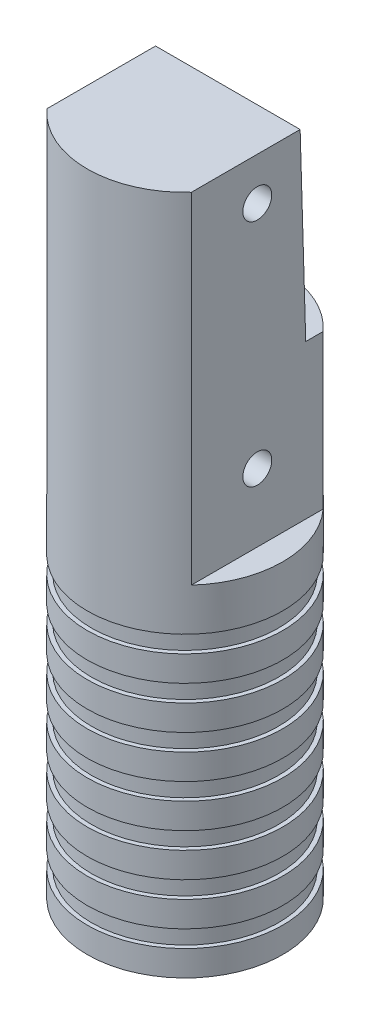
from build123d import *

# Parameters (mm, degrees)
SKETCH2_W                      = 11.5
SKETCH2_H                      = 40
SKETCH3_W                      = 0.5
SKETCH3_H                      = 2
LPATTERN1_COUNT                = 7
LPATTERN1_PITCH                = 5
BOSS_EXTRUDE1_DEPTH            = 40
F_15_0_15_DIAMETER_HOLE1_D     = 15
F_15_0_15_DIAMETER_HOLE1_DEPTH = 40
F_15_0_15_DIAMETER_HOLE1_TIP   = 4.506454643
M3_CLEARANCE_HOLE1_D           = 3.4
CUT_EXTRUDE1_DEPTH             = 44.179856415
CUT_EXTRUDE1_DEPTH_BACK        = 44.179856415
SKETCH16_R                     = 1.7


with BuildPart() as part:
    # Sketch2 → Revolve1 (revolve)
    with BuildSketch(Plane.XY):
        with Locations((-5.75, -20)):
            Rectangle(SKETCH2_W, SKETCH2_H)
    revolve(axis=Axis((0, 0, 0), (0, -1, 0)))

    # Sketch3 → Cut-Revolve1 (revolve, cut)
    with BuildSketch(Plane.XY):
        with Locations((11.25, -36)):
            Rectangle(SKETCH3_W, SKETCH3_H)
    cut_revolve1 = revolve(axis=Axis((0, 0, 0), (0, -1, 0)), mode=Mode.SUBTRACT)

    # LPattern1: Cut-Revolve1 ×7
    with Locations(*[(0, i * LPATTERN1_PITCH, 0) for i in range(1, LPATTERN1_COUNT)]):
        add(cut_revolve1, mode=Mode.SUBTRACT)

    # Sketch6 → Boss-Extrude1 (add)
    with BuildSketch(Plane(origin=(0, 0, 0), x_dir=(1, 0, 0), z_dir=(0, 1, 0))):
        with BuildLine():
            Line((-8.5, 7.745966692), (-8.5, -7.745966692))
            ThreePointArc((-8.5, -7.745966692), (0, -11.5), (8.5, -7.745966692))
            Line((8.5, -7.745966692), (8.5, 7.745966692))
            ThreePointArc((8.5, 7.745966692), (0, 11.5), (-8.5, 7.745966692))
        make_face()
    extrude(amount=BOSS_EXTRUDE1_DEPTH)

    # Ø15.0 (15) Diameter Hole1
    with Locations(Plane.XZ.offset(40)):
        with Locations((0, 0)):
            Hole(F_15_0_15_DIAMETER_HOLE1_D / 2, depth=F_15_0_15_DIAMETER_HOLE1_DEPTH)
            with Locations((0, 0, -(F_15_0_15_DIAMETER_HOLE1_DEPTH + F_15_0_15_DIAMETER_HOLE1_TIP / 2))):  # 118° drill point
                Cone(0, F_15_0_15_DIAMETER_HOLE1_D / 2, F_15_0_15_DIAMETER_HOLE1_TIP, mode=Mode.SUBTRACT)

    # M3 Clearance Hole1 (through all)
    with Locations(Plane(origin=(8.5, 0, 0), x_dir=(0, 0, -1), z_dir=(1, 0, 0))):
        with Locations((0, 8), (0, 35)):
            Hole(M3_CLEARANCE_HOLE1_D / 2)

    # Sketch16 → Cut-Extrude1 (cut, two sides: drawn at the far end of the back side and taken through both)
    with BuildSketch(Plane(origin=(0, 0, 0), x_dir=(0, 0, -1), z_dir=(1, 0, 0)).offset(-CUT_EXTRUDE1_DEPTH_BACK)):
        with Locations((0, 8)):
            Circle(SKETCH16_R)
        with Locations((0, 35)):
            Circle(SKETCH16_R)
        Polygon((5.037728025, 40), (5.6954411, 18.081644681), (11.5, 18.081644681), (11.5, 40), (7.745966692, 40), align=None)
    extrude(amount=CUT_EXTRUDE1_DEPTH + CUT_EXTRUDE1_DEPTH_BACK, mode=Mode.SUBTRACT)


solid = part.part
